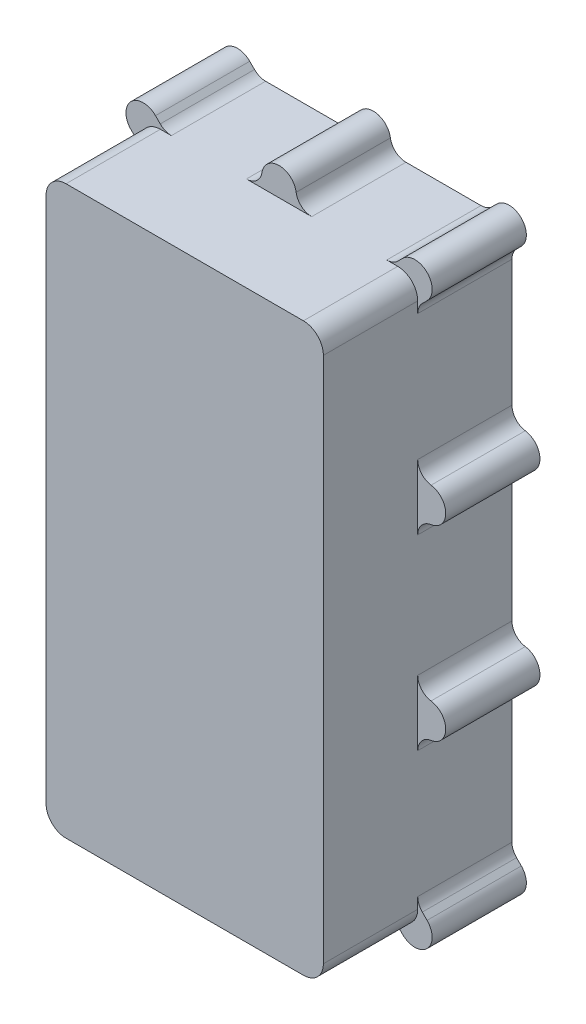
from build123d import *

# Parameters (mm, degrees)
SKETCH3_W               = 76.2
SKETCH3_H               = 168.275
BOSS_EXTRUDE1_DEPTH     = 53.975
SHELL1_T                = 6
FILLET1_R               = 5.334
FILLET2_R               = 6.35
CUT_EXTRUDE1_DEPTH      = 1.2446
FILLET3_R               = 0.254
FILLET4_R               = 0.127
SKETCH7_W               = 76.2
SKETCH7_H               = 2.5
BOSS_EXTRUDE2_DEPTH     = 53.975
BOSS_EXTRUDE3_DEPTH     = 29.972
SKETCH9_R               = 3.025
CUT_EXTRUDE2_DEPTH      = 9
MIRROR2_COPY_1_DEPTH    = 29.972
MIRROR2_COPY_2_SKETCH_R = 3.025
MIRROR2_COPY_2_DEPTH    = 9
BOSS_EXTRUDE4_DEPTH     = 29.972
SKETCH11_R              = 3.025
CUT_EXTRUDE3_DEPTH      = 9
BOSS_EXTRUDE5_DEPTH     = 29.972
SKETCH13_R              = 3.025
CUT_EXTRUDE4_DEPTH      = 9
SKETCH17_R              = 9.525
SKETCH17_R_2            = 6.35
CUT_EXTRUDE6_DEPTH      = 6
SKETCH18_R              = 14.2875
SKETCH18_R_2            = 10.795
CUT_EXTRUDE7_DEPTH      = 3
FILLET5_R               = 5


with BuildPart() as part:
    # Sketch3 → Boss-Extrude1 (new body)
    with BuildSketch(Plane.XY):
        with Locations((38.1, 84.1375)):
            Rectangle(SKETCH3_W, SKETCH3_H)
    extrude(amount=BOSS_EXTRUDE1_DEPTH)

    # Shell1
    shell1_openings = [part.faces().sort_by_distance(p)[0] for p in [
        (38.1, 84.1375, 0),
    ]]
    offset(amount=SHELL1_T, openings=shell1_openings, kind=Kind.INTERSECTION)

    # Fillet1
    # the kernel refuses this fillet: 5.334 mm, written as the material it adds along each edge
    with BuildSketch(Plane(origin=(0, 168.275, 0), x_dir=(1, 0, 0), z_dir=(0, 0, 1)), Plane(origin=(76.2, 0, 0), x_dir=(-1, 0, 0), z_dir=(0, 0, 1)), Plane(origin=(76.2, 168.275, 0), x_dir=(0, -1, 0), z_dir=(0, 0, 1))) as fillet1_piece_1:
        with BuildLine():
            CenterArc((FILLET1_R, -FILLET1_R), FILLET1_R, 90, 90)
            Line((0, -FILLET1_R), (0, 0))
            Line((0, 0), (FILLET1_R, 0))
        make_face()
    extrude(amount=53.975)
    with BuildSketch(Plane(origin=(0, 0, 0), x_dir=(1, 0, 0), z_dir=(0, 0, 1))) as fillet1_piece_2:
        with BuildLine():
            CenterArc((FILLET1_R, FILLET1_R), FILLET1_R, 180, 90)
            Line((0, FILLET1_R), (0, 0))
            Line((0, 0), (FILLET1_R, 0))
        make_face()
    extrude(amount=53.975)

    # Fillet2
    fillet2_edges = [part.edges().sort_by_distance(p)[0] for p in [
        (-6, 174.275, 29.9875),
        (82.2, 174.275, 29.9875),
        (82.2, -6, 29.9875),
        (-6, -6, 29.9875),
    ]]
    fillet(fillet2_edges, radius=FILLET2_R)

    # Sketch6 → Cut-Extrude1 (cut)
    with BuildSketch(Plane(origin=(0, 0, 0), x_dir=(-1, 0, 0), z_dir=(0, 0, -1))):
        with BuildLine():
            Line((-5.334, 172.5577), (-70.866, 172.5577))
            ThreePointArc((-70.866, 172.5577), (-77.666033783, 169.741033783), (-80.4827, 162.941))
            Line((-80.4827, 162.941), (-80.4827, 5.334))
            ThreePointArc((-80.4827, 5.334), (-77.666033783, -1.466033783), (-70.866, -4.2827))
            Line((-70.866, -4.2827), (-5.334, -4.2827))
            ThreePointArc((-5.334, -4.2827), (1.466033783, -1.466033783), (4.2827, 5.334))
            Line((4.2827, 5.334), (4.2827, 162.941))
            ThreePointArc((4.2827, 162.941), (1.466033783, 169.741033783), (-5.334, 172.5577))
        make_face()
        with BuildLine():
            Line((-77.9173, 162.941), (-77.9173, 5.334))
            ThreePointArc((-77.9173, 5.334), (-75.852022046, 0.347977954), (-70.866, -1.7173))
            Line((-70.866, -1.7173), (-5.334, -1.7173))
            ThreePointArc((-5.334, -1.7173), (-0.347977954, 0.347977954), (1.7173, 5.334))
            Line((1.7173, 5.334), (1.7173, 162.941))
            ThreePointArc((1.7173, 162.941), (-0.347977954, 167.927022046), (-5.334, 169.9923))
            Line((-5.334, 169.9923), (-70.866, 169.9923))
            ThreePointArc((-70.866, 169.9923), (-75.852022046, 167.927022046), (-77.9173, 162.941))
        make_face(mode=Mode.SUBTRACT)
    extrude(amount=-CUT_EXTRUDE1_DEPTH, mode=Mode.SUBTRACT)

    # Fillet3
    fillet3_edges = [part.edges().sort_by_distance(p)[0] for p in [
        (-1.466033783, 169.741033783, 1.2446),
        (-4.2827, 84.1375, 1.2446),
        (-1.466033783, -1.466033783, 1.2446),
        (38.1, -4.2827, 1.2446),
        (77.666033783, -1.466033783, 1.2446),
        (80.4827, 84.1375, 1.2446),
        (77.666033783, 169.741033783, 1.2446),
        (38.1, 172.5577, 1.2446),
        (38.1, 169.9923, 1.2446),
        (75.852022046, 167.927022046, 1.2446),
        (77.9173, 84.1375, 1.2446),
        (75.852022046, 0.347977954, 1.2446),
        (38.1, -1.7173, 1.2446),
        (0.347977954, 0.347977954, 1.2446),
        (-1.7173, 84.1375, 1.2446),
        (0.347977954, 167.927022046, 1.2446),
    ]]
    fillet(fillet3_edges, radius=FILLET3_R)

    # Fillet4
    fillet4_edges = [part.edges().sort_by_distance(p)[0] for p in [
        (-1.7173, 84.1375, 0),
        (0.347977954, 0.347977954, 0),
        (38.1, -1.7173, 0),
        (75.852022046, 0.347977954, 0),
        (77.9173, 84.1375, 0),
        (-1.466033783, 169.741033783, 0),
        (38.1, 172.5577, 0),
        (77.666033783, 169.741033783, 0),
        (80.4827, 84.1375, 0),
        (77.666033783, -1.466033783, 0),
        (38.1, -4.2827, 0),
        (-1.466033783, -1.466033783, 0),
        (-4.2827, 84.1375, 0),
        (75.852022046, 167.927022046, 0),
        (38.1, 169.9923, 0),
        (0.347977954, 167.927022046, 0),
    ]]
    fillet(fillet4_edges, radius=FILLET4_R)

    # Sketch7 → Boss-Extrude2 (add)
    with BuildSketch(Plane(origin=(0, 0, 53.975), x_dir=(-1, 0, 0), z_dir=(0, 0, -1))):
        with Locations((-38.1, 33.25)):
            Rectangle(SKETCH7_W, SKETCH7_H)
    extrude(amount=BOSS_EXTRUDE2_DEPTH)

    # Sketch8 → Boss-Extrude3 (add)
    with BuildSketch(Plane(origin=(0, 0, 0), x_dir=(-1, 0, 0), z_dir=(0, 0, -1))):
        with BuildLine():
            ThreePointArc((6, 0.35), (5.516635031, -2.080039796), (4.140128061, -4.140128061))
            ThreePointArc((4.140128061, -4.140128061), (2.080039796, -5.516635031), (-0.35, -6))
            Line((-0.35, -6), (-1.778174593, -6))
            Line((-1.778174593, -6), (1.202282953, -8.980457546))
            ThreePointArc((1.202282953, -8.980457546), (8.980457546, -8.980457546), (8.980457546, -1.202282953))
            Line((8.980457546, -1.202282953), (6, 1.778174593))
            Line((6, 1.778174593), (6, 0.35))
        make_face()
    boss_extrude3 = extrude(amount=-BOSS_EXTRUDE3_DEPTH)

    # Sketch9 → Cut-Extrude2 (cut)
    with BuildSketch(Plane(origin=(0, 0, 0), x_dir=(-1, 0, 0), z_dir=(0, 0, -1))):
        with Locations((5.09137025, -5.09137025)):
            Circle(SKETCH9_R)
    cut_extrude2 = extrude(amount=-CUT_EXTRUDE2_DEPTH, mode=Mode.SUBTRACT)

    # Mirror1: Boss-Extrude3, Cut-Extrude2 across plane
    add(boss_extrude3.mirror(Plane.ZY.offset(-38.1)))
    add(cut_extrude2.mirror(Plane.ZY.offset(-38.1)), mode=Mode.SUBTRACT)

    # Mirror2: Boss-Extrude3, Cut-Extrude2 across plane
    add(boss_extrude3.mirror(Plane(origin=(0, 84.1375, 0), x_dir=(0, 0, 1), z_dir=(0, -1, 0))))
    add(cut_extrude2.mirror(Plane(origin=(0, 84.1375, 0), x_dir=(0, 0, 1), z_dir=(0, -1, 0))), mode=Mode.SUBTRACT)

    # Mirror2 copy 1 sketch → Mirror2 copy 1 (add)
    with BuildSketch(Plane(origin=(76.2, 168.275, 0), x_dir=(1, 0, 0), z_dir=(0, 0, -1))):
        with BuildLine():
            ThreePointArc((6, 0.35), (5.516635031, -2.080039796), (4.140128061, -4.140128061))
            ThreePointArc((4.140128061, -4.140128061), (2.080039796, -5.516635031), (-0.35, -6))
            Line((-0.35, -6), (-1.778174593, -6))
            Line((-1.778174593, -6), (1.202282953, -8.980457546))
            ThreePointArc((1.202282953, -8.980457546), (8.980457546, -8.980457546), (8.980457546, -1.202282953))
            Line((8.980457546, -1.202282953), (6, 1.778174593))
            Line((6, 1.778174593), (6, 0.35))
        make_face()
    extrude(amount=-MIRROR2_COPY_1_DEPTH)

    # Mirror2 copy 2 sketch → Mirror2 copy 2 (cut)
    with BuildSketch(Plane(origin=(76.2, 168.275, 0), x_dir=(1, 0, 0), z_dir=(0, 0, -1))):
        with Locations((5.09137025, -5.09137025)):
            Circle(MIRROR2_COPY_2_SKETCH_R)
    extrude(amount=-MIRROR2_COPY_2_DEPTH, mode=Mode.SUBTRACT)

    # Sketch10 → Boss-Extrude4 (add)
    with BuildSketch(Plane(origin=(0, 0, 0), x_dir=(-1, 0, 0), z_dir=(0, 0, -1))):
        with BuildLine():
            Line((6, 108.3555), (9.4097, 108.3555))
            ThreePointArc((9.4097, 108.3555), (14.9097, 113.8555), (9.4097, 119.3555))
            Line((9.4097, 119.3555), (6, 119.3555))
            Line((6, 119.3555), (6, 108.3555))
        make_face()
        with BuildLine():
            Line((9.4097, 59.9195), (6, 59.9195))
            Line((6, 59.9195), (6, 48.9195))
            Line((6, 48.9195), (9.4097, 48.9195))
            ThreePointArc((9.4097, 48.9195), (14.9097, 54.4195), (9.4097, 59.9195))
        make_face()
    boss_extrude4 = extrude(amount=-BOSS_EXTRUDE4_DEPTH)

    # Sketch11 → Cut-Extrude3 (cut)
    with BuildSketch(Plane(origin=(0, 0, 0), x_dir=(-1, 0, 0), z_dir=(0, 0, -1))):
        with Locations((9.4097, 54.4195)):
            Circle(SKETCH11_R)
        with Locations((9.4097, 113.8555)):
            Circle(SKETCH11_R)
    cut_extrude3 = extrude(amount=-CUT_EXTRUDE3_DEPTH, mode=Mode.SUBTRACT)

    # Mirror3: Boss-Extrude4, Cut-Extrude3 across plane
    add(boss_extrude4.mirror(Plane.ZY.offset(-38.1)))
    add(cut_extrude3.mirror(Plane.ZY.offset(-38.1)), mode=Mode.SUBTRACT)

    # Sketch12 → Boss-Extrude5 (add)
    with BuildSketch(Plane(origin=(0, 0, 0), x_dir=(-1, 0, 0), z_dir=(0, 0, -1))):
        with BuildLine():
            Line((-43.6, -6), (-43.6, -9.4097))
            ThreePointArc((-43.6, -9.4097), (-38.1, -14.9097), (-32.6, -9.4097))
            Line((-32.6, -9.4097), (-32.6, -6))
            Line((-32.6, -6), (-43.6, -6))
        make_face()
    boss_extrude5 = extrude(amount=-BOSS_EXTRUDE5_DEPTH)

    # Sketch13 → Cut-Extrude4 (cut)
    with BuildSketch(Plane(origin=(0, 0, 0), x_dir=(-1, 0, 0), z_dir=(0, 0, -1))):
        with Locations((-38.1, -9.4097)):
            Circle(SKETCH13_R)
    cut_extrude4 = extrude(amount=-CUT_EXTRUDE4_DEPTH, mode=Mode.SUBTRACT)

    # Mirror4: Boss-Extrude5, Cut-Extrude4 across plane
    add(boss_extrude5.mirror(Plane(origin=(0, 84.1375, 0), x_dir=(0, 0, 1), z_dir=(0, -1, 0))))
    add(cut_extrude4.mirror(Plane(origin=(0, 84.1375, 0), x_dir=(0, 0, 1), z_dir=(0, -1, 0))), mode=Mode.SUBTRACT)

    # Sketch17 → Cut-Extrude6 (cut)
    with BuildSketch(Plane.ZY.offset(6)):
        with Locations(Location((38.385, 85.3, 0), (0, 0, 270))):
            Circle(SKETCH17_R)
        with Locations(Location((38.385, 18.667, 0), (0, 0, 270))):
            Circle(SKETCH17_R_2)
    extrude(amount=-CUT_EXTRUDE6_DEPTH, mode=Mode.SUBTRACT)

    # Sketch18 → Cut-Extrude7 (cut)
    with BuildSketch(Plane(origin=(0, 0, 0), x_dir=(0, 0, -1), z_dir=(1, 0, 0))):
        with Locations(Location((-38.385, 85.3, 0), (0, 0, 90))):
            Circle(SKETCH18_R)
        with Locations(Location((-38.385, 18.667, 0), (0, 0, 90))):
            Circle(SKETCH18_R_2)
    extrude(amount=-CUT_EXTRUDE7_DEPTH, mode=Mode.SUBTRACT)

    # Fillet5
    # the kernel refuses this fillet: 5 mm, written as the material it adds along each edge
    with BuildSketch(Plane(origin=(1.778174593, -6, 0), x_dir=(-0.7071067811865485, -0.7071067811865468, 0), z_dir=(0, 0, 1)), Plane(origin=(-6, 1.778174593, 0), x_dir=(0, 1, 0), z_dir=(0, 0, 1)), Plane(origin=(74.421825407, -6, 0), x_dir=(-1, 0, 0), z_dir=(0, 0, 1)), Plane(origin=(82.2, 1.778174593, 0), x_dir=(0.7071067811865556, -0.7071067811865394, 0), z_dir=(0, 0, 1)), Plane(origin=(82.2, 166.496825407, 0), x_dir=(0, -1, 0), z_dir=(0, 0, 1))) as fillet5_piece_1:
        with BuildLine():
            CenterArc((FILLET5_R * 0.414213562373, FILLET5_R), FILLET5_R, 225, 45)
            Line((-FILLET5_R * 0.292893218813, FILLET5_R * 0.292893218813), (0, 0))
            Line((0, 0), (FILLET5_R * 0.414213562373, 0))
        make_face()
    extrude(amount=29.972)
    with BuildSketch(Plane(origin=(32.6, -6, 0), x_dir=(-1, 0, 0), z_dir=(0, 0, 1)), Plane(origin=(82.2, 48.9195, 0), x_dir=(0, -1, 0), z_dir=(0, 0, 1)), Plane(origin=(82.2, 108.3555, 0), x_dir=(0, -1, 0), z_dir=(0, 0, 1)), Plane(origin=(43.6, 174.275, 0), x_dir=(1, 0, 0), z_dir=(0, 0, 1)), Plane(origin=(-6, 119.3555, 0), x_dir=(0, 1, 0), z_dir=(0, 0, 1)), Plane(origin=(-6, 59.9195, 0), x_dir=(0, 1, 0), z_dir=(0, 0, 1))) as fillet5_piece_2:
        with BuildLine():
            CenterArc((4.878870165, 5), FILLET5_R, 188.711379563, 81.288620437)
            Line((-0.063448961, 4.242714286), (-0.557680874, 4.166985714))
            ThreePointArc((-0.557680874, 4.166985714), (-0.5, 3.4097), (-0.5, 0))
            Line((-0.5, 0), (0, -0.5))
            Line((0, -0.5), (4.878870165, -0.5))
            Line((4.878870165, -0.5), (4.878870165, 0))
        make_face()
    extrude(amount=29.972)
    with BuildSketch(Plane(origin=(43.6, -6, 0), x_dir=(1, 0, 0), z_dir=(0, 0, 1)), Plane(origin=(82.2, 59.9195, 0), x_dir=(0, 1, 0), z_dir=(0, 0, 1)), Plane(origin=(82.2, 119.3555, 0), x_dir=(0, 1, 0), z_dir=(0, 0, 1)), Plane(origin=(32.6, 174.275, 0), x_dir=(-1, 0, 0), z_dir=(0, 0, 1)), Plane(origin=(-6, 108.3555, 0), x_dir=(0, -1, 0), z_dir=(0, 0, 1)), Plane(origin=(-6, 48.9195, 0), x_dir=(0, -1, 0), z_dir=(0, 0, 1))) as fillet5_piece_3:
        with BuildLine():
            CenterArc((4.878870165, -5), FILLET5_R, 90, 81.288620437)
            Line((-0.063448961, -4.242714286), (-0.557680874, -4.166985714))
            ThreePointArc((-0.557680874, -4.166985714), (-0.5, -3.4097), (-0.5, 0))
            Line((-0.5, 0), (0, 0.5))
            Line((0, 0.5), (4.878870165, 0.5))
            Line((4.878870165, 0.5), (4.878870165, 0))
        make_face()
    extrude(amount=29.972)
    with BuildSketch(Plane(origin=(74.421825407, 174.275, 0), x_dir=(-1, 0, 0), z_dir=(0, 0, 1)), Plane(origin=(1.778174593, 174.275, 0), x_dir=(-0.707106781186546, 0.7071067811865489, 0), z_dir=(0, 0, 1)), Plane(origin=(-6, 166.496825407, 0), x_dir=(0, -1, 0), z_dir=(0, 0, 1))) as fillet5_piece_4:
        with BuildLine():
            CenterArc((FILLET5_R * 0.414213562373, -FILLET5_R), FILLET5_R, 90, 45)
            Line((-FILLET5_R * 0.292893218813, -FILLET5_R * 0.292893218813), (0, 0))
            Line((0, 0), (FILLET5_R * 0.414213562373, 0))
        make_face()
    extrude(amount=29.972)


solid = part.part
